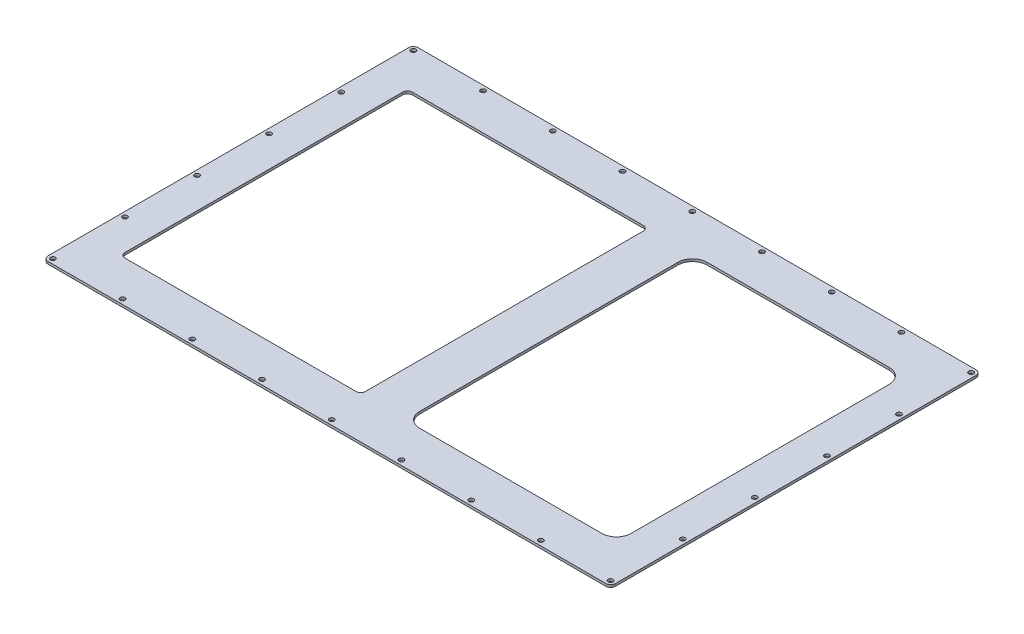
from build123d import *

# Parameters (mm, degrees)
SKETCH_1_W                  = 1165
SKETCH_1_H                  = 760
SKETCH_1_W_2                = 494
SKETCH_1_H_2                = 590
SKETCH_1_W_3                = 434
EXTRUDE_1_DEPTH             = 2.5
FILLET_1_R                  = 10
FILLET_2_R                  = 30
SKETCH_2_R                  = 5
CUT_EXTRUDE_1_DEPTH         = 696.507907935
PATTERN_LINEAR_1_COUNT      = 6
PATTERN_LINEAR_1_PITCH      = 148
PATTERN_LINEAR_1_COUNT_DIR2 = 9
PATTERN_LINEAR_1_PITCH_DIR2 = 143.125


with BuildPart() as part:
    # Эскиз1 → Бобышка-Вытянуть1 (new, symmetric)
    with BuildSketch(Plane(origin=(0, 0, 0), x_dir=(1, 0, 0), z_dir=(0, 1, 0))):
        Rectangle(SKETCH_1_W, SKETCH_1_H)
        with Locations((-262.5, 0)):
            Rectangle(SKETCH_1_W_2, SKETCH_1_H_2, mode=Mode.SUBTRACT)
        with Locations((292.5, 0)):
            Rectangle(SKETCH_1_W_3, SKETCH_1_H_2, mode=Mode.SUBTRACT)
    extrude(amount=EXTRUDE_1_DEPTH, both=True)

    # Скругление1
    fillet_1_edges = [part.edges().sort_by_distance(p)[0] for p in [
        (582.5, 0, 380),
        (-582.5, 0, 380),
        (582.5, 0, -380),
        (-582.5, 0, -380),
        (-15.5, 0, 295),
        (-509.5, 0, 295),
        (-15.5, 0, -295),
        (-509.5, 0, -295),
    ]]
    fillet(fillet_1_edges, radius=FILLET_1_R)

    # Скругление2
    fillet_2_edges = [part.edges().sort_by_distance(p)[0] for p in [
        (75.5, 0, 295),
        (509.5, 0, 295),
        (509.5, 0, -295),
        (75.5, 0, -295),
    ]]
    fillet(fillet_2_edges, radius=FILLET_2_R)

    # Эскиз2 → Вырез-Вытянуть1 (cut, through all)
    with BuildSketch(Plane(origin=(0, 2.5, 0), x_dir=(1, 0, 0), z_dir=(0, 1, 0))):
        with Locations((-572.5, -370)):
            Circle(SKETCH_2_R)
    cut_extrude_1 = extrude(amount=-CUT_EXTRUDE_1_DEPTH, mode=Mode.SUBTRACT)

    # Линейный массив1: Cut-Extrude 1 6 × 9, 25 skipped
    with Locations(*[(j * PATTERN_LINEAR_1_PITCH_DIR2, 0, -i * PATTERN_LINEAR_1_PITCH) for i in range(PATTERN_LINEAR_1_COUNT) for j in range(PATTERN_LINEAR_1_COUNT_DIR2) if (i, j) not in ((0, 0), (1, 1), (1, 2), (1, 3), (1, 4), (1, 5), (1, 6), (1, 7), (2, 1), (2, 2), (2, 3), (2, 4), (2, 5), (2, 6), (2, 7), (3, 1), (3, 2), (3, 3), (3, 4), (3, 5), (3, 6), (3, 7), (4, 1), (4, 2), (4, 3), (4, 4))]):
        add(cut_extrude_1, mode=Mode.SUBTRACT)


solid = part.part
